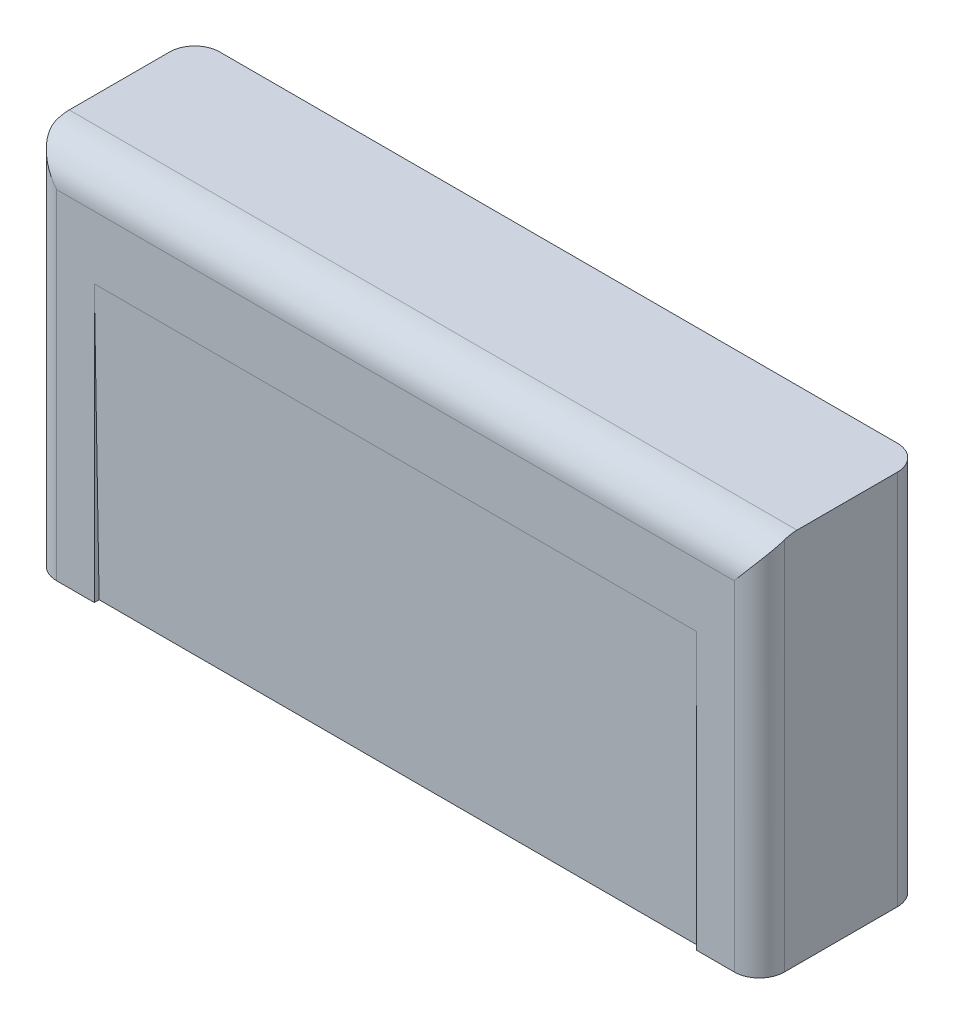
from build123d import *

# Parameters (mm, degrees)
SKETCH1_W                   = 58
SKETCH1_H                   = 13
BOSS_EXTRUDE1_DEPTH         = 30
FILLET1_R                   = 2
FILLET2_R                   = 3
M6_TAPPED_HOLE1_D           = 5
M6_TAPPED_HOLE1_DEPTH       = 17
M6_TAPPED_HOLE1_CSINK_D     = 6.05
M6_TAPPED_HOLE1_CSINK_ANGLE = 90
M6_TAPPED_HOLE1_TIP         = 1.502151548
CUT_EXTRUDE1_DEPTH          = 24


with BuildPart() as part:
    # Sketch1 → Boss-Extrude1 (new body)
    with BuildSketch(Plane(origin=(0, 0, 0), x_dir=(1, 0, 0), z_dir=(0, 1, 0))):
        Rectangle(SKETCH1_W, SKETCH1_H)
    extrude(amount=-BOSS_EXTRUDE1_DEPTH)

    # Fillet1
    fillet1_edges = [part.edges().sort_by_distance(p)[0] for p in [
        (29, -15, 6.5),
        (-29, -15, 6.5),
        (-29, -15, -6.5),
        (29, -15, -6.5),
    ]]
    fillet(fillet1_edges, radius=FILLET1_R)

    # Fillet2
    # the kernel refuses this fillet: 3 mm, written as the material it takes off along each edge
    with BuildSketch(Plane(origin=(-34.5, 0, 6.5), x_dir=(0, -1, 0), z_dir=(1, 0, 0))) as fillet2_piece_1:
        with BuildLine():
            CenterArc((FILLET2_R, FILLET2_R), FILLET2_R, 180, 90)
            Line((0, FILLET2_R), (0, 0))
            Line((0, 0), (FILLET2_R, 0))
        make_face()
    extrude(amount=69, mode=Mode.SUBTRACT)

    # M6 Tapped Hole1
    with Locations(Plane(origin=(0, -30, 0), x_dir=(-1, 0, 0), z_dir=(0, -1, 0))):
        with Locations((-21.5, 0), (21.5, 0)):
            CounterSinkHole(M6_TAPPED_HOLE1_D / 2, M6_TAPPED_HOLE1_CSINK_D / 2, depth=M6_TAPPED_HOLE1_DEPTH, counter_sink_angle=M6_TAPPED_HOLE1_CSINK_ANGLE)
            with Locations((0, 0, -(M6_TAPPED_HOLE1_DEPTH + M6_TAPPED_HOLE1_TIP / 2))):  # 118° drill point
                Cone(0, M6_TAPPED_HOLE1_D / 2, M6_TAPPED_HOLE1_TIP, mode=Mode.SUBTRACT)

    # Sketch5 → Cut-Extrude1 (cut, symmetric)
    with BuildSketch(Plane(origin=(0, 0, 0), x_dir=(0, 0, -1), z_dir=(1, 0, 0))):
        Polygon((-6.5, -8), (-6.115988572, -30), (-6.5, -30), align=None)
    extrude(amount=CUT_EXTRUDE1_DEPTH, both=True, mode=Mode.SUBTRACT)


solid = part.part
